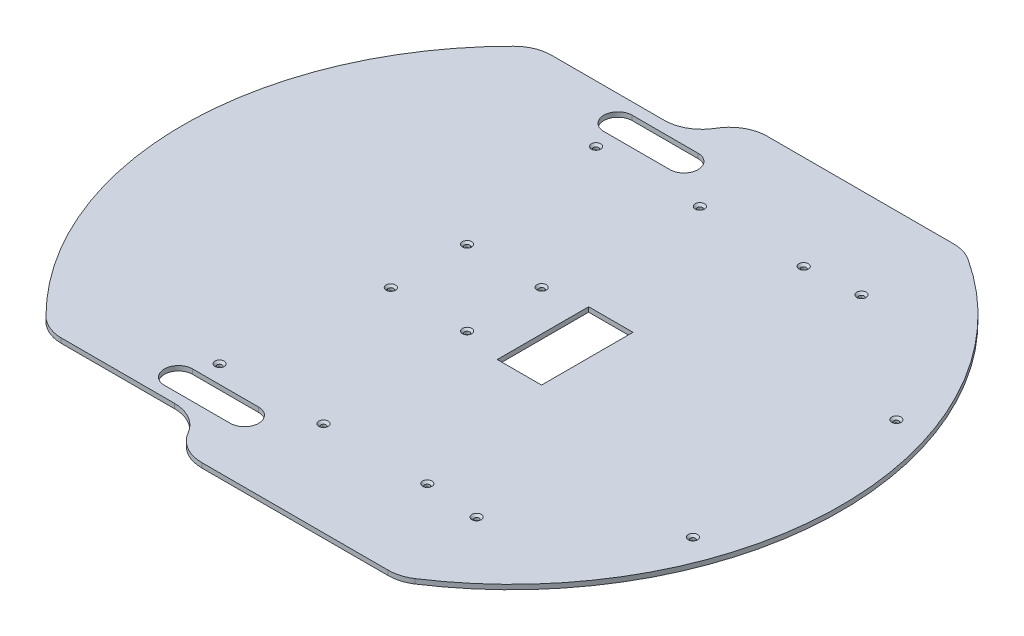
from build123d import *

# Parameters (mm, degrees)
BOSS_EXTRU_1_DEPTH                             = 3.18
ESQUISSE2_W                                    = 29.85
ESQUISSE2_H                                    = 61.6
ENL_V_MAT_EXTRU_1_DEPTH                        = 3.18
FRAISAGE_POUR_VIS_T_TE_FRAIS_E_M31_D           = 3.4
FRAISAGE_POUR_VIS_T_TE_FRAIS_E_M31_CSINK_D     = 6.3
FRAISAGE_POUR_VIS_T_TE_FRAIS_E_M31_CSINK_ANGLE = 90
FRAISAGE_POUR_VIS_T_TE_FRAIS_E_M33_D           = 3.6
FRAISAGE_POUR_VIS_T_TE_FRAIS_E_M33_CSINK_D     = 6.3
FRAISAGE_POUR_VIS_T_TE_FRAIS_E_M33_CSINK_ANGLE = 90


with BuildPart() as part:
    # Esquisse1 → Boss.-Extru.1 (new body)
    with BuildSketch(Plane(origin=(0, 0, 0), x_dir=(1, 0, 0), z_dir=(0, 1, 0))):
        with BuildLine():
            Line((-138.94, 165.455), (-62.65, 165.455))
            ThreePointArc((-62.65, 165.455), (-49.94832469, 168.857215998), (-40.65, 178.155))
            ThreePointArc((-40.65, 178.155), (-31.35167531, 187.452784002), (-18.65, 190.855))
            Line((-18.65, 190.855), (106.95, 190.855))
            ThreePointArc((106.95, 190.855), (114.162170552, 189.807407008), (120.78, 186.755))
            ThreePointArc((120.78, 186.755), (221.783950682, 0.355), (120.78, -186.045))
            ThreePointArc((120.78, -186.045), (114.162170552, -189.097407008), (106.95, -190.145))
            Line((106.95, -190.145), (-18.65, -190.145))
            ThreePointArc((-18.65, -190.145), (-31.35167531, -186.742784002), (-40.65, -177.445))
            ThreePointArc((-40.65, -177.445), (-49.94832469, -168.147215998), (-62.65, -164.745))
            Line((-62.65, -164.745), (-138.94, -164.745))
            ThreePointArc((-138.94, -164.745), (-148.655863056, -162.664054344), (-156.83, -157.015))
            ThreePointArc((-156.83, -157.015), (-222.037491914, 0.355), (-156.83, 157.725))
            ThreePointArc((-156.83, 157.725), (-148.655863056, 163.374054344), (-138.94, 165.455))
        make_face()
    extrude(amount=BOSS_EXTRU_1_DEPTH)

    # Esquisse2 → Enlèv. mat.-Extru.1 (cut)
    with BuildSketch(Plane(origin=(0, 3.18, 0), x_dir=(1, 0, 0), z_dir=(0, 1, 0))):
        with BuildLine():
            Line((-76.45, -138.575), (-32, -138.575))
            ThreePointArc((-32, -138.575), (-22.47, -148.105), (-32, -157.635))
            Line((-32, -157.635), (-76.45, -157.635))
            ThreePointArc((-76.45, -157.635), (-85.98, -148.105), (-76.45, -138.575))
        make_face()
        with BuildLine():
            Line((-76.45, 138.575), (-32, 138.575))
            ThreePointArc((-32, 138.575), (-22.47, 148.105), (-32, 157.635))
            Line((-32, 157.635), (-76.45, 157.635))
            ThreePointArc((-76.45, 157.635), (-85.98, 148.105), (-76.45, 138.575))
        make_face()
        with Locations((35.625, 0.375)):
            Rectangle(ESQUISSE2_W, ESQUISSE2_H)
    extrude(amount=-ENL_V_MAT_EXTRU_1_DEPTH, mode=Mode.SUBTRACT)

    # Fraisage pour vis à tête fraisée M31 (through all)
    with Locations(Plane(origin=(-70.35, 3.18, 126.475), x_dir=(0, 0, 1), z_dir=(0, 1, 0))):
        with Locations((0, 0), (0, 69.98), (0, 139.96), (2.87, 176.05), (-58.27, 260.67), (-195.39, 260.67), (-256.53, 176.05), (-253.66, 139.96), (-253.66, 69.98), (-253.66, 0)):
            CounterSinkHole(FRAISAGE_POUR_VIS_T_TE_FRAIS_E_M31_D / 2, FRAISAGE_POUR_VIS_T_TE_FRAIS_E_M31_CSINK_D / 2, counter_sink_angle=FRAISAGE_POUR_VIS_T_TE_FRAIS_E_M31_CSINK_ANGLE)

    # Fraisage pour vis à tête fraisée M33 (through all)
    with Locations(Plane(origin=(-56.702279254, 3.18, -26.617875519), x_dir=(0, 0, 1), z_dir=(0, 1, 0))):
        with Locations((0, 0), (0, 50.276636833), (50.601243407, 50.6422972), (50.936723508, -0.430840353)):
            CounterSinkHole(FRAISAGE_POUR_VIS_T_TE_FRAIS_E_M33_D / 2, FRAISAGE_POUR_VIS_T_TE_FRAIS_E_M33_CSINK_D / 2, counter_sink_angle=FRAISAGE_POUR_VIS_T_TE_FRAIS_E_M33_CSINK_ANGLE)


solid = part.part
